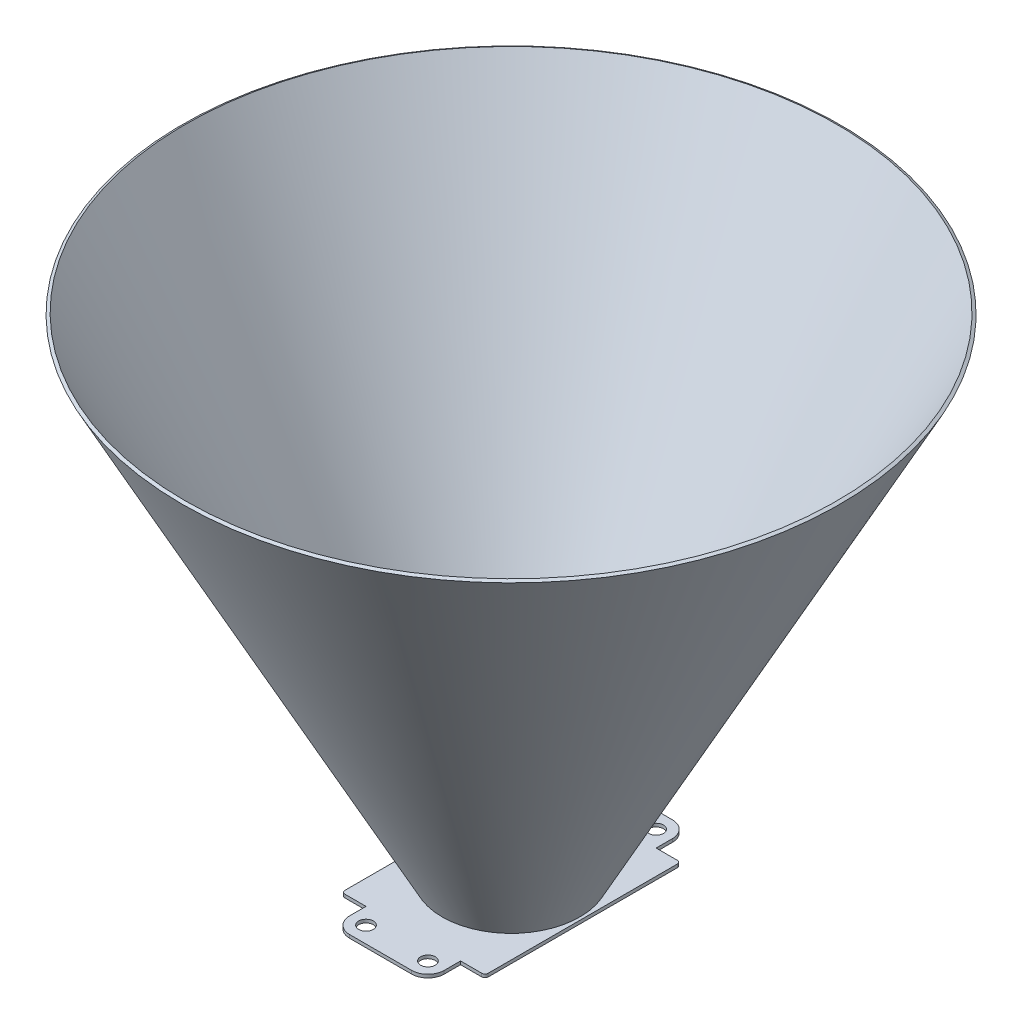
from build123d import *

# Parameters (mm, degrees)
SKETCH1_W           = 88
SKETCH1_H           = 120
BOSS_EXTRUDE1_DEPTH = 2
SKETCH2_R           = 40
CUT_EXTRUDE1_DEPTH  = 2
SKETCH4_W           = 58
SKETCH4_H           = 20
SKETCH4_R           = 4.5
BOSS_EXTRUDE2_DEPTH = 2
FILLET1_R           = 10
FILLET2_R           = 2


# Read off the part's stored shape, not the designer's step: Thicken1
with BuildPart() as part:
    # Sketch1 → Boss-Extrude1 (new body)
    with BuildSketch(Plane(origin=(0, 0, 0), x_dir=(1, 0, 0), z_dir=(0, 1, 0))):
        Rectangle(SKETCH1_W, SKETCH1_H)
    extrude(amount=BOSS_EXTRUDE1_DEPTH)

    # Sketch2 → Cut-Extrude1 (cut)
    with BuildSketch(Plane(origin=(0, 2, 0), x_dir=(1, 0, 0), z_dir=(0, 1, 0))):
        with Locations(Location((0, 0, 0), (0, 0, 270))):
            Circle(SKETCH2_R)
    extrude(amount=-CUT_EXTRUDE1_DEPTH, mode=Mode.SUBTRACT)

    # Thicken1 outline → Thicken1 (revolve)
    with BuildSketch(Plane.XY):
        Polygon((201.764705882, 301.058823529), (200, 302), (40, 2), (42.266666667, 2), align=None)
    revolve(axis=Axis((0, 0, 0), (0, 1, 0)))

    # Sketch4 → Boss-Extrude2 (add)
    # profile 1 of 2: a face of its own
    with BuildSketch(Plane.XZ):
        with Locations((0, 70)):
            Rectangle(SKETCH4_W, SKETCH4_H)
        with Locations(Location((19, 70, 0), (0, 0, 270))):
            Circle(SKETCH4_R, mode=Mode.SUBTRACT)
        with Locations(Location((-19, 70, 0), (0, 0, 90))):
            Circle(SKETCH4_R, mode=Mode.SUBTRACT)
    # profile 2 of 2: a face of its own
    with BuildSketch(Plane.XZ):
        with Locations((0, -70)):
            Rectangle(SKETCH4_W, SKETCH4_H)
        with Locations(Location((-19, -70, 0), (0, 0, 270))):
            Circle(SKETCH4_R, mode=Mode.SUBTRACT)
        with Locations(Location((19, -70, 0), (0, 0, 90))):
            Circle(SKETCH4_R, mode=Mode.SUBTRACT)
    extrude(amount=-BOSS_EXTRUDE2_DEPTH)

    # Fillet1
    fillet1_edges = [part.edges().sort_by_distance(p)[0] for p in [
        (-29, 1, 80),
        (29, 1, 80),
        (29, 1, -80),
        (-29, 1, -80),
    ]]
    fillet(fillet1_edges, radius=FILLET1_R)

    # Fillet2
    fillet2_edges = [part.edges().sort_by_distance(p)[0] for p in [
        (44, 1, 60),
        (-44, 1, 60),
        (-44, 1, -60),
        (44, 1, -60),
    ]]
    fillet(fillet2_edges, radius=FILLET2_R)


solid = part.part
